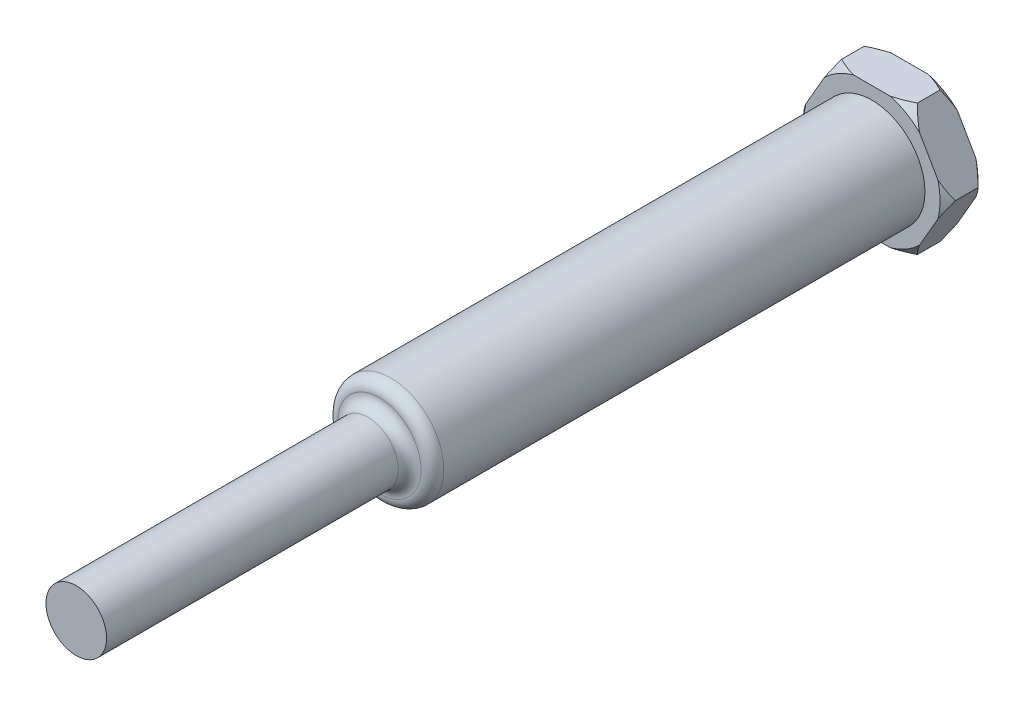
from build123d import *

# Parameters (mm, degrees)
BOSS_EXTRUDE1_DEPTH = 5
SKETCH2_R           = 7
BOSS_EXTRUDE2_DEPTH = 65
SKETCH3_R           = 4
BOSS_EXTRUDE3_DEPTH = 40
FILLET1_R           = 1.5


with BuildPart() as part:
    # Sketch1 → Boss-Extrude1 (new body)
    with BuildSketch(Plane.XY):
        Polygon((5, -8.660254038), (10, 0), (5, 8.660254038), (-5, 8.660254038), (-10, 0), (-5, -8.660254038), align=None)
    extrude(amount=BOSS_EXTRUDE1_DEPTH)

    # Sketch2 → Boss-Extrude2 (add)
    with BuildSketch(Plane.XY.offset(5)):
        Circle(SKETCH2_R)
    extrude(amount=BOSS_EXTRUDE2_DEPTH)

    # Sketch3 → Boss-Extrude3 (add)
    with BuildSketch(Plane.XY.offset(70)):
        Circle(SKETCH3_R)
    extrude(amount=BOSS_EXTRUDE3_DEPTH)

    # Fillet1
    fillet1_edges = [part.edges().sort_by_distance(p)[0] for p in [
        (-7, 0, 70),
        (-4, 0, 70),
    ]]
    fillet(fillet1_edges, radius=FILLET1_R - 0.0001)  # a hair under: the kernel refuses the full size

    # Sketch5 → Cut-Revolve1 (revolve, cut)
    with BuildSketch(Plane(origin=(0, 0, 0), x_dir=(1, 0, 0), z_dir=(0, 1, 0)), mode=Mode.PRIVATE) as cut_revolve1_sk:
        Polygon((-10, -1), (-9, 0), (-10, 0), align=None)
        Polygon((-10, -4), (-9, -5), (-10, -5), align=None)
    revolve(cut_revolve1_sk.sketch.rotate(Axis((0, 0, 0), (0, 0, 1)), 180), axis=Axis((0, 0, 0), (0, 0, 1)), mode=Mode.SUBTRACT)


solid = part.part
